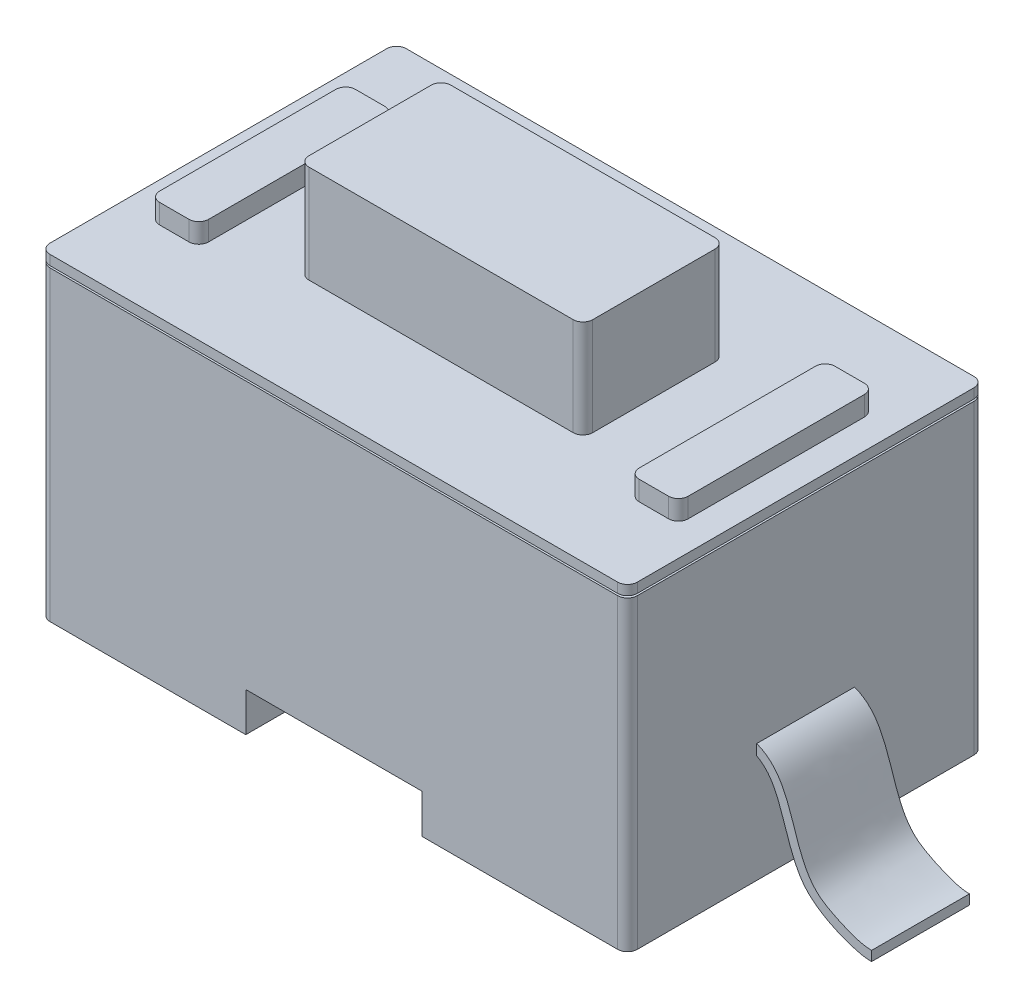
from build123d import *

# Parameters (mm, degrees)
SKETCH1_W           = 6
SKETCH1_H           = 3.64
BOSS_EXTRUDE1_DEPTH = 3.25
SKETCH2_W           = 2.9
SKETCH2_H           = 1.45
BOSS_EXTRUDE2_DEPTH = 1
SKETCH3_W           = 0.5
SKETCH3_H           = 2
BOSS_EXTRUDE3_DEPTH = 0.2
FILLET1_R           = 0.1
SKETCH4_W           = 6.273612193
SKETCH4_H           = 3.809222638
SKETCH4_W_2         = 5.919575883
SKETCH4_H_2         = 3.566405206
CUT_EXTRUDE1_DEPTH  = 0.02
FILLET2_R           = 0.1
SKETCH5_W           = 1.8
SKETCH5_H           = 0.4
CUT_EXTRUDE2_DEPTH  = 5.02
BOSS_EXTRUDE4_START = -0.5
BOSS_EXTRUDE4_DEPTH = 1


# Read off the part's stored shape, not the designer's step: Boss-Extrude4
with BuildPart() as part:
    # Sketch1 → Boss-Extrude1 (new body)
    with BuildSketch(Plane(origin=(0, 0, 0), x_dir=(1, 0, 0), z_dir=(0, 1, 0))):
        Rectangle(SKETCH1_W, SKETCH1_H)
    extrude(amount=BOSS_EXTRUDE1_DEPTH)

    # Sketch2 → Boss-Extrude2 (add)
    with BuildSketch(Plane(origin=(0, 3.25, 0), x_dir=(1, 0, 0), z_dir=(0, 1, 0))):
        Rectangle(SKETCH2_W, SKETCH2_H)
    extrude(amount=BOSS_EXTRUDE2_DEPTH)

    # Sketch3 → Boss-Extrude3 (add)
    with BuildSketch(Plane(origin=(0, 3.25, 0), x_dir=(1, 0, 0), z_dir=(0, 1, 0))):
        with Locations((-2.45, 0)):
            Rectangle(SKETCH3_W, SKETCH3_H)
        with Locations((2.45, 0)):
            Rectangle(SKETCH3_W, SKETCH3_H)
    extrude(amount=BOSS_EXTRUDE3_DEPTH)

    # Fillet1
    fillet1_edges = [part.edges().sort_by_distance(p)[0] for p in [
        (-1.45, 3.75, -0.725),
        (-1.45, 3.75, 0.725),
        (1.45, 3.75, 0.725),
        (1.45, 3.75, -0.725),
        (-2.7, 3.35, -1),
        (-2.7, 3.35, 1),
        (-2.2, 3.35, 1),
        (-2.2, 3.35, -1),
        (2.2, 3.35, -1),
        (2.2, 3.35, 1),
        (2.7, 3.35, 1),
        (2.7, 3.35, -1),
    ]]
    fillet(fillet1_edges, radius=FILLET1_R)

    # Sketch4 → Cut-Extrude1 (cut)
    with BuildSketch(Plane(origin=(0, 3.15, 0), x_dir=(1, 0, 0), z_dir=(0, 1, 0))):
        with Locations((-0.037546102, -0.013653128)):
            Rectangle(SKETCH4_W, SKETCH4_H)
        with Locations((0.010712352, -0.001469434)):
            Rectangle(SKETCH4_W_2, SKETCH4_H_2, mode=Mode.SUBTRACT)
    extrude(amount=-CUT_EXTRUDE1_DEPTH, mode=Mode.SUBTRACT)

    # Fillet2
    fillet2_edges = [part.edges().sort_by_distance(p)[0] for p in [
        (-3, 1.565, -1.82),
        (3, 1.565, -1.82),
        (3, 1.565, 1.82),
        (-3, 1.565, 1.82),
        (-2.94907559, 3.14, -1.781733169),
        (2.970500293, 3.14, -1.781733169),
        (2.970500293, 3.14, 1.784672037),
        (-2.94907559, 3.14, 1.784672037),
        (-3, 3.2, -1.82),
        (3, 3.2, -1.82),
        (3, 3.2, 1.82),
        (-3, 3.2, 1.82),
    ]]
    fillet(fillet2_edges, radius=FILLET2_R)

    # Sketch5 → Cut-Extrude2 (cut)
    with BuildSketch(Plane(origin=(0, 0, -1.82), x_dir=(-1, 0, 0), z_dir=(0, 0, -1))):
        with Locations((0, 0.2)):
            Rectangle(SKETCH5_W, SKETCH5_H)
    extrude(amount=-CUT_EXTRUDE2_DEPTH, mode=Mode.SUBTRACT)

    # Boss-Extrude4 outline → Boss-Extrude4 (add)
    with BuildSketch(Plane.XY.offset(BOSS_EXTRUDE4_START)):
        with BuildLine():
            Line((4.173146956, -0.131659711), (4.173759731, -0.031661589))
            add(Edge.make_bspline(
                [(4.173759731, -0.031661589), (4.060884449, -0.030969905), (3.862308969, 0.050205488), (3.325841553, 0.329858602), (3.401409137, 1.062439588), (3, 1.211404175)],
                knots=[0, 0, 0, 0, 0.203003015, 0.331433955, 1, 1, 1, 1], degree=3))
            Line((3, 1.211404175), (3, 1.102542921))
            add(Edge.make_bspline(
                [(3, 1.102542921), (3.09279535, 1.055379151), (3.226381881, 0.869010627), (3.326243834, 0.475899683), (3.482197094, 0.170683307), (3.700920866, 0.013413394), (3.917304218, -0.082452634), (4.088231211, -0.131134455), (4.173146956, -0.131659711)],
                knots=[0.026799616, 0.026799616, 0.026799616, 0.026799616, 0.25, 0.5, 0.625, 0.75, 0.875, 1, 1, 1, 1], degree=3))
        make_face()
        with BuildLine():
            Line((-3, 1.102542921), (-3, 1.211404175))
            add(Edge.make_bspline(
                [(-3, 1.211404175), (-3.401409137, 1.062439588), (-3.325841553, 0.329858602), (-3.862308969, 0.050205488), (-4.060884449, -0.030969905), (-4.173759731, -0.031661589)],
                knots=[0, 0, 0, 0, 0.668566045, 0.796996985, 1, 1, 1, 1], degree=3))
            Line((-4.173759731, -0.031661589), (-4.173146956, -0.131659711))
            add(Edge.make_bspline(
                [(-4.173146956, -0.131659711), (-4.009862358, -0.125892663), (-3.668802958, -0.046437584), (-3.359459873, 0.383160744), (-3.261093668, 0.825417205), (-3.129401541, 1.021566363), (-3.02801046, 1.087631493), (-3.010284263, 1.097420299), (-3, 1.102542921)],
                knots=[0, 0, 0, 0, 0.25, 0.5, 0.75, 0.960893979, 0.976536388, 1, 1, 1, 1], degree=3))
        make_face()
    extrude(amount=BOSS_EXTRUDE4_DEPTH)


solid = part.part
